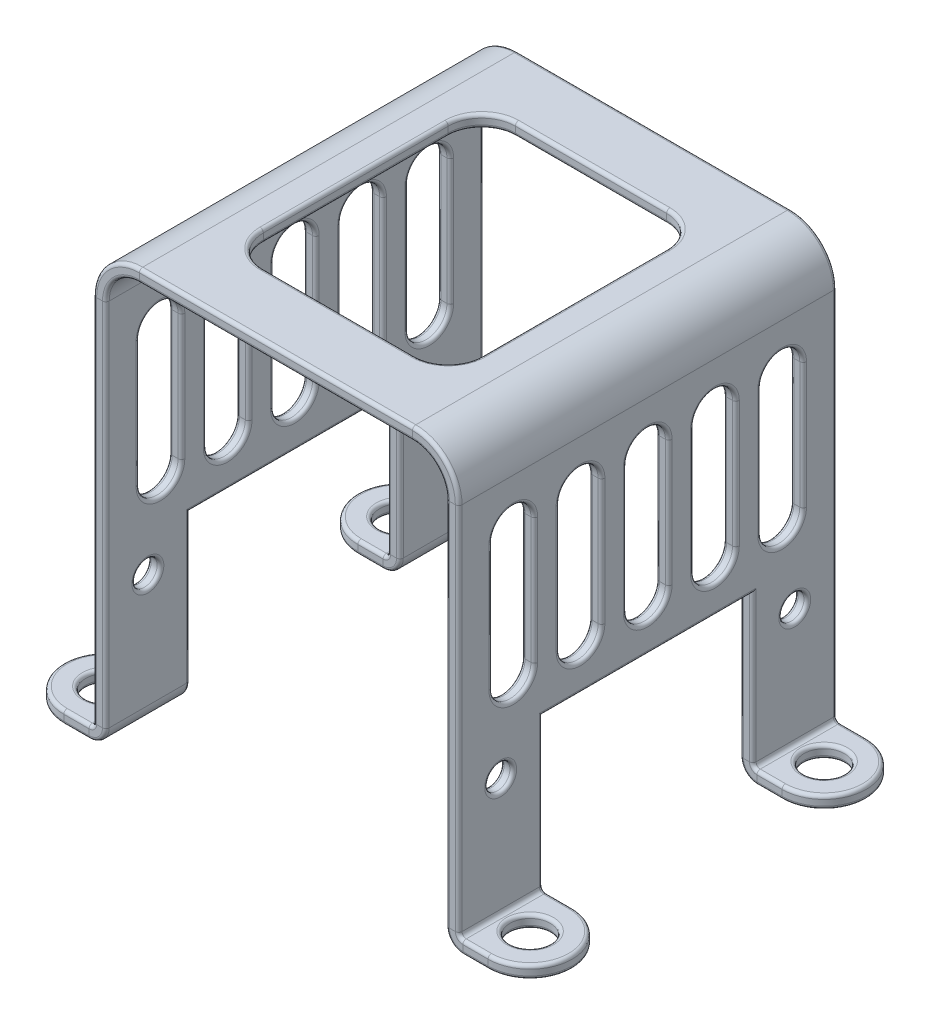
from build123d import *

# Parameters (mm, degrees)
BASE_FLANGE1_DEPTH             = 11.25
SKETCH6_R                      = 0.75
SKETCH6_W                      = 12.5
SKETCH6_H                      = 9.75
CUT_EXTRUDE1_DEPTH             = 36.534314402
EDGE_FLANGE1_STRIP_W           = 3.5
EDGE_FLANGE1_STRIP_H           = 0.75
EDGE_FLANGE1_STRIP_CUT_DEPTH   = 5
EDGE_FLANGE1_STRIP_2_W         = 3.5
EDGE_FLANGE1_STRIP_2_H         = 0.75
EDGE_FLANGE1_STRIP_CUT_2_DEPTH = 5
EDGE_FLANGE1_STRIP_3_W         = 3.5
EDGE_FLANGE1_STRIP_3_H         = 0.75
EDGE_FLANGE1_STRIP_CUT_3_DEPTH = 5
EDGE_FLANGE1_STRIP_4_W         = 3.5
EDGE_FLANGE1_STRIP_4_H         = 0.75
EDGE_FLANGE1_STRIP_CUT_4_DEPTH = 5
EDGE_FLANGE1_DEPTH             = 5
EDGE_FLANGE1_BEND_DEPTH        = 5
EDGE_FLANGE1_BEND_2_DEPTH      = 5
EDGE_FLANGE1_BEND_3_DEPTH      = 5
CUT_EXTRUDE2_DEPTH             = 10
FILLET1_RADIUS                 = 2.5
FILLET1_LENGTH                 = 0.75
FILLET2_RADIUS                 = 2.5
FILLET2_LENGTH                 = 0.75
FILLET3_RADIUS                 = 2.5
FILLET3_LENGTH                 = 0.75
FILLET4_RADIUS                 = 2.5
FILLET4_LENGTH                 = 0.75
M2_CLEARANCE_HOLE1_D           = 2.4
FILLET5_R                      = 0.2


# Sheet-metal steps are written as plain solids
with BuildPart() as part:
    # Sketch1 → Base-Flange1 (new, symmetric)
    with BuildSketch(Plane.XY):
        with BuildLine():
            Line((-10.125, 0), (-10.125, 23))
            ThreePointArc((-10.125, 23), (-9.539213562, 24.414213562), (-8.125, 25))
            Line((-8.125, 25), (8.125, 25))
            ThreePointArc((8.125, 25), (9.539213562, 24.414213562), (10.125, 23))
            Line((10.125, 23), (10.125, 0))
            Line((10.125, 0), (10.875, 0))
            Line((10.875, 0), (10.875, 23))
            ThreePointArc((10.875, 23), (10.069543648, 24.944543648), (8.125, 25.75))
            Line((8.125, 25.75), (-8.125, 25.75))
            ThreePointArc((-8.125, 25.75), (-10.069543648, 24.944543648), (-10.875, 23))
            Line((-10.875, 23), (-10.875, 0))
            Line((-10.875, 0), (-10.125, 0))
        make_face()
    extrude(amount=BASE_FLANGE1_DEPTH, both=True)

    # Sketch6 → Cut-Extrude1 (cut, through all)
    with BuildSketch(Plane(origin=(10.875, 0, 0), x_dir=(0, 0, -1), z_dir=(1, 0, 0))):
        with Locations((8.75, 7.75)):
            Circle(SKETCH6_R)
        with Locations(Location((-8.75, 7.75, 0), (0, 0, 180))):
            Circle(SKETCH6_R)
        with Locations((0, 4.875)):
            Rectangle(SKETCH6_W, SKETCH6_H)
        with BuildLine():
            Line((1.25, 20.125), (1.25, 12.625))
            ThreePointArc((1.25, 12.625), (0, 11.375), (-1.25, 12.625))
            Line((-1.25, 12.625), (-1.25, 20.125))
            ThreePointArc((-1.25, 20.125), (0, 21.375), (1.25, 20.125))
        make_face()
        with BuildLine():
            Line((2.75, 20.125), (2.75, 12.625))
            ThreePointArc((2.75, 12.625), (4, 11.375), (5.25, 12.625))
            Line((5.25, 12.625), (5.25, 20.125))
            ThreePointArc((5.25, 20.125), (4, 21.375), (2.75, 20.125))
        make_face()
        with BuildLine():
            Line((6.75, 20.125), (6.75, 12.625))
            ThreePointArc((6.75, 12.625), (8, 11.375), (9.25, 12.625))
            Line((9.25, 12.625), (9.25, 20.125))
            ThreePointArc((9.25, 20.125), (8, 21.375), (6.75, 20.125))
        make_face()
        with BuildLine():
            Line((-9.25, 20.125), (-9.25, 12.625))
            ThreePointArc((-9.25, 12.625), (-8, 11.375), (-6.75, 12.625))
            Line((-6.75, 12.625), (-6.75, 20.125))
            ThreePointArc((-6.75, 20.125), (-8, 21.375), (-9.25, 20.125))
        make_face()
        with BuildLine():
            Line((-5.25, 20.125), (-5.25, 12.625))
            ThreePointArc((-5.25, 12.625), (-4, 11.375), (-2.75, 12.625))
            Line((-2.75, 12.625), (-2.75, 20.125))
            ThreePointArc((-2.75, 20.125), (-4, 21.375), (-5.25, 20.125))
        make_face()
    extrude(amount=-CUT_EXTRUDE1_DEPTH, mode=Mode.SUBTRACT)

    # Edge-Flange1 strip (across the edge) → Edge-Flange1 strip cut (cut)
    with BuildSketch(Plane(origin=(10.875, 0, -6.25), x_dir=(0, 1, 0), z_dir=(0, 0, -1))):
        with Locations((-0.75, -0.375)):
            Rectangle(EDGE_FLANGE1_STRIP_W, EDGE_FLANGE1_STRIP_H)
    extrude(amount=EDGE_FLANGE1_STRIP_CUT_DEPTH, mode=Mode.SUBTRACT)

    # Edge-Flange1 strip 2 (across the edge) → Edge-Flange1 strip cut 2 (cut)
    with BuildSketch(Plane(origin=(10.875, 0, 11.25), x_dir=(0, 1, 0), z_dir=(0, 0, -1))):
        with Locations((-0.75, -0.375)):
            Rectangle(EDGE_FLANGE1_STRIP_2_W, EDGE_FLANGE1_STRIP_2_H)
    extrude(amount=EDGE_FLANGE1_STRIP_CUT_2_DEPTH, mode=Mode.SUBTRACT)

    # Edge-Flange1 strip 3 (across the edge) → Edge-Flange1 strip cut 3 (cut)
    with BuildSketch(Plane(origin=(-10.875, 0, 6.25), x_dir=(0, 1, 0), z_dir=(0, 0, 1))):
        with Locations((-0.75, -0.375)):
            Rectangle(EDGE_FLANGE1_STRIP_3_W, EDGE_FLANGE1_STRIP_3_H)
    extrude(amount=EDGE_FLANGE1_STRIP_CUT_3_DEPTH, mode=Mode.SUBTRACT)

    # Edge-Flange1 strip 4 (across the edge) → Edge-Flange1 strip cut 4 (cut)
    with BuildSketch(Plane(origin=(-10.875, 0, -11.25), x_dir=(0, 1, 0), z_dir=(0, 0, 1))):
        with Locations((-0.75, -0.375)):
            Rectangle(EDGE_FLANGE1_STRIP_4_W, EDGE_FLANGE1_STRIP_4_H)
    extrude(amount=EDGE_FLANGE1_STRIP_CUT_4_DEPTH, mode=Mode.SUBTRACT)

    # Edge-Flange1 section (across the edge) → Edge-Flange1 (add)
    with BuildSketch(Plane(origin=(10.875, 0, -6.25), x_dir=(0, 1, 0), z_dir=(0, 0, -1))):
        with BuildLine():
            Line((0, 0.25), (0, 4.25))
            Line((0, 4.25), (0.75, 4.25))
            Line((0.75, 4.25), (0.75, 0.25))
            ThreePointArc((0.75, 0.25), (0.823223305, 0.073223305), (1, 0))
            Line((1, 0), (1, -0.75))
            ThreePointArc((1, -0.75), (0.292893219, -0.457106781), (0, 0.25))
        make_face()
    extrude(amount=EDGE_FLANGE1_DEPTH)

    # Edge-Flange1 section 2 (across the edge) → Edge-Flange1 bend (add)
    with BuildSketch(Plane(origin=(10.875, 0, 11.25), x_dir=(0, 1, 0), z_dir=(0, 0, -1))):
        with BuildLine():
            Line((0, 0.25), (0, 4.25))
            Line((0, 4.25), (0.75, 4.25))
            Line((0.75, 4.25), (0.75, 0.25))
            ThreePointArc((0.75, 0.25), (0.823223305, 0.073223305), (1, 0))
            Line((1, 0), (1, -0.75))
            ThreePointArc((1, -0.75), (0.292893219, -0.457106781), (0, 0.25))
        make_face()
    extrude(amount=EDGE_FLANGE1_BEND_DEPTH)

    # Edge-Flange1 section 3 (across the edge) → Edge-Flange1 bend 2 (add)
    with BuildSketch(Plane(origin=(-10.875, 0, 6.25), x_dir=(0, 1, 0), z_dir=(0, 0, 1))):
        with BuildLine():
            Line((0, 0.25), (0, 4.25))
            Line((0, 4.25), (0.75, 4.25))
            Line((0.75, 4.25), (0.75, 0.25))
            ThreePointArc((0.75, 0.25), (0.823223305, 0.073223305), (1, 0))
            Line((1, 0), (1, -0.75))
            ThreePointArc((1, -0.75), (0.292893219, -0.457106781), (0, 0.25))
        make_face()
    extrude(amount=EDGE_FLANGE1_BEND_2_DEPTH)

    # Edge-Flange1 section 4 (across the edge) → Edge-Flange1 bend 3 (add)
    with BuildSketch(Plane(origin=(-10.875, 0, -11.25), x_dir=(0, 1, 0), z_dir=(0, 0, 1))):
        with BuildLine():
            Line((0, 0.25), (0, 4.25))
            Line((0, 4.25), (0.75, 4.25))
            Line((0.75, 4.25), (0.75, 0.25))
            ThreePointArc((0.75, 0.25), (0.823223305, 0.073223305), (1, 0))
            Line((1, 0), (1, -0.75))
            ThreePointArc((1, -0.75), (0.292893219, -0.457106781), (0, 0.25))
        make_face()
    extrude(amount=EDGE_FLANGE1_BEND_3_DEPTH)

    # Sketch19 → Cut-Extrude2 (cut)
    with BuildSketch(Plane(origin=(0, 25.75, 0), x_dir=(1, 0, 0), z_dir=(0, 1, 0))):
        with BuildLine():
            Line((4.5, -7.5), (-4.5, -7.5))
            ThreePointArc((-4.5, -7.5), (-5.914213562, -6.914213562), (-6.5, -5.5))
            Line((-6.5, -5.5), (-6.5, 5.5))
            ThreePointArc((-6.5, 5.5), (-5.914213562, 6.914213562), (-4.5, 7.5))
            Line((-4.5, 7.5), (4.5, 7.5))
            ThreePointArc((4.5, 7.5), (5.914213562, 6.914213562), (6.5, 5.5))
            Line((6.5, 5.5), (6.5, -5.5))
            ThreePointArc((6.5, -5.5), (5.914213562, -6.914213562), (4.5, -7.5))
        make_face()
    extrude(amount=-CUT_EXTRUDE2_DEPTH, mode=Mode.SUBTRACT)

    # Fillet1: full round fillet: the end face becomes a half cylinder, R = half its width
    fillet1_face = Plane((-15.125, 0.375, 8.75), x_dir=(0, -1, 0), z_dir=(-1, 0, 0))  # on the end face: x along it, z out of the body
    fillet1_slab = fillet1_face.offset(-FILLET1_RADIUS / 2) * Box(FILLET1_LENGTH, 2 * FILLET1_RADIUS, FILLET1_RADIUS, mode=Mode.PRIVATE)  # the body's end, R deep
    fillet1_round = Plane((-12.625, 0.375, 8.75), x_dir=(-1, 0, 0), z_dir=(0, -1, 0)) * Cylinder(FILLET1_RADIUS, FILLET1_LENGTH, mode=Mode.PRIVATE)  # its axis R under the face
    add(fillet1_slab - fillet1_round, mode=Mode.SUBTRACT)

    # Fillet2: full round fillet: the end face becomes a half cylinder, R = half its width
    fillet2_face = Plane((-15.125, 0.375, -8.75), x_dir=(0, -1, 0), z_dir=(-1, 0, 0))  # on the end face: x along it, z out of the body
    fillet2_slab = fillet2_face.offset(-FILLET2_RADIUS / 2) * Box(FILLET2_LENGTH, 2 * FILLET2_RADIUS, FILLET2_RADIUS, mode=Mode.PRIVATE)  # the body's end, R deep
    fillet2_round = Plane((-12.625, 0.375, -8.75), x_dir=(-1, 0, 0), z_dir=(0, -1, 0)) * Cylinder(FILLET2_RADIUS, FILLET2_LENGTH, mode=Mode.PRIVATE)  # its axis R under the face
    add(fillet2_slab - fillet2_round, mode=Mode.SUBTRACT)

    # Fillet3: full round fillet: the end face becomes a half cylinder, R = half its width
    fillet3_face = Plane((15.125, 0.375, -8.75), x_dir=(0, -1, 0), z_dir=(1, 0, 0))  # on the end face: x along it, z out of the body
    fillet3_slab = fillet3_face.offset(-FILLET3_RADIUS / 2) * Box(FILLET3_LENGTH, 2 * FILLET3_RADIUS, FILLET3_RADIUS, mode=Mode.PRIVATE)  # the body's end, R deep
    fillet3_round = Plane((12.625, 0.375, -8.75), x_dir=(1, 0, 0), z_dir=(0, -1, 0)) * Cylinder(FILLET3_RADIUS, FILLET3_LENGTH, mode=Mode.PRIVATE)  # its axis R under the face
    add(fillet3_slab - fillet3_round, mode=Mode.SUBTRACT)

    # Fillet4: full round fillet: the end face becomes a half cylinder, R = half its width
    fillet4_face = Plane((15.125, 0.375, 8.75), x_dir=(0, -1, 0), z_dir=(1, 0, 0))  # on the end face: x along it, z out of the body
    fillet4_slab = fillet4_face.offset(-FILLET4_RADIUS / 2) * Box(FILLET4_LENGTH, 2 * FILLET4_RADIUS, FILLET4_RADIUS, mode=Mode.PRIVATE)  # the body's end, R deep
    fillet4_round = Plane((12.625, 0.375, 8.75), x_dir=(1, 0, 0), z_dir=(0, -1, 0)) * Cylinder(FILLET4_RADIUS, FILLET4_LENGTH, mode=Mode.PRIVATE)  # its axis R under the face
    add(fillet4_slab - fillet4_round, mode=Mode.SUBTRACT)

    # M2 Clearance Hole1 (through all)
    with Locations(Plane(origin=(0, 0.75, 0), x_dir=(1, 0, 0), z_dir=(0, 1, 0))):
        with Locations((-12.625, 8.75), (12.625, 8.75), (12.625, -8.75), (-12.625, -8.75)):
            Hole(M2_CLEARANCE_HOLE1_D / 2)

    # Fillet5
    fillet5_edges = [part.edges().sort_by_distance(p)[0] for p in [
        (10.125, 7.75, -8),
        (-10.125, 7.75, -8),
        (-10.875, 7.75, -8),
        (10.875, 7.75, -8),
        (10.125, 7.75, 8),
        (-10.125, 7.75, 8),
        (-10.875, 7.75, 8),
        (10.875, 7.75, 8),
        (-10.069543648, 24.944543648, -11.25),
        (0, 25.75, -11.25),
        (-10.125, 21.375, 0),
        (10.125, 21.375, 0),
        (-10.875, 21.375, 0),
        (-10.125, 16.375, -1.25),
        (10.069543648, 24.944543648, -11.25),
        (10.125, 16.375, -1.25),
        (-10.875, 16.375, -1.25),
        (-10.125, 11.375, 0),
        (10.125, 11.375, 0),
        (-10.875, 11.375, 0),
        (-10.125, 16.375, 1.25),
        (10.125, 16.375, 1.25),
        (-10.875, 16.375, 1.25),
        (10.875, 21.375, 0),
        (10.875, 16.375, 1.25),
        (10.875, 11.375, 0),
        (10.875, 16.375, -1.25),
        (9.539213562, 24.414213562, -11.25),
        (-10.125, 21.375, -4),
        (10.125, 21.375, -4),
        (-10.875, 21.375, -4),
        (-10.125, 16.375, -5.25),
        (10.125, 16.375, -5.25),
        (-10.875, 16.375, -5.25),
        (-10.125, 11.375, -4),
        (0, 25, -11.25),
        (10.125, 11.375, -4),
        (-10.875, 11.375, -4),
        (-10.125, 16.375, -2.75),
        (10.125, 16.375, -2.75),
        (-10.875, 16.375, -2.75),
        (-10.125, 12, 11.25),
        (10.875, 21.375, -4),
        (10.875, 16.375, -2.75),
        (10.875, 11.375, -4),
        (10.875, 16.375, -5.25),
        (-9.539213562, 24.414213562, -11.25),
        (-10.125, 12, -11.25),
        (-10.125, 21.375, 4),
        (10.125, 21.375, 4),
        (-10.875, 21.375, 4),
        (-10.125, 16.375, 2.75),
        (10.125, 16.375, 2.75),
        (-10.875, 16.375, 2.75),
        (-10.125, 11.375, 4),
        (10.125, 11.375, 4),
        (-10.875, 11.375, 4),
        (-10.125, 16.375, 5.25),
        (-10.875, 12, -11.25),
        (10.125, 16.375, 5.25),
        (-10.875, 16.375, 5.25),
        (10.875, 21.375, 4),
        (10.875, 16.375, 5.25),
        (10.875, 11.375, 4),
        (10.875, 16.375, 2.75),
        (-10.125, 21.375, 8),
        (10.125, 21.375, 8),
        (-10.875, 21.375, 8),
        (-10.125, 16.375, 6.75),
        (10.125, 16.375, 6.75),
        (-10.875, 16.375, 6.75),
        (-10.125, 11.375, 8),
        (10.125, 11.375, 8),
        (-10.875, 11.375, 8),
        (-10.125, 16.375, 9.25),
        (10.125, 16.375, 9.25),
        (-10.875, 16.375, 9.25),
        (10.875, 21.375, 8),
        (10.875, 16.375, 9.25),
        (10.875, 11.375, 8),
        (10.875, 16.375, 6.75),
        (-9.539213562, 24.414213562, 11.25),
        (-10.125, 21.375, -8),
        (10.125, 21.375, -8),
        (-10.875, 21.375, -8),
        (-10.125, 16.375, -9.25),
        (10.125, 16.375, -9.25),
        (-10.875, 16.375, -9.25),
        (-10.125, 11.375, -8),
        (10.125, 11.375, -8),
        (-10.875, 11.375, -8),
        (-10.125, 16.375, -6.75),
        (10.125, 16.375, -6.75),
        (-10.875, 16.375, -6.75),
        (10.875, 21.375, -8),
        (10.875, 16.375, -6.75),
        (10.875, 11.375, -8),
        (10.875, 16.375, -9.25),
        (-10.125, 5.375, 6.25),
        (-10.875, 5.375, 6.25),
        (-10.125, 9.75, 0),
        (10.125, 9.75, 0),
        (-10.875, 9.75, 0),
        (10.125, 5.375, -6.25),
        (10.875, 5.375, 6.25),
        (10.875, 9.75, 0),
        (0, 25, 11.25),
        (9.539213562, 24.414213562, 11.25),
        (10.875, 5.375, -6.25),
        (10.875, 12, -11.25),
        (10.125, 12, -11.25),
        (10.125, 5.375, 6.25),
        (10.875, 12, 11.25),
        (10.125, 12, 11.25),
        (-10.125, 5.375, -6.25),
        (-10.875, 5.375, -6.25),
        (10.417893219, 0.292893219, -6.25),
        (10.417893219, 0.292893219, -11.25),
        (10.948223305, 0.823223305, -6.25),
        (10.948223305, 0.823223305, -11.25),
        (11.875, 0.75, -11.25),
        (11.875, 0, -11.25),
        (10.417893219, 0.292893219, 11.25),
        (10.417893219, 0.292893219, 6.25),
        (10.948223305, 0.823223305, 11.25),
        (10.948223305, 0.823223305, 6.25),
        (11.875, 0.75, 6.25),
        (11.875, 0, 6.25),
        (-10.417893219, 0.292893219, 6.25),
        (-10.417893219, 0.292893219, 11.25),
        (-10.948223305, 0.823223305, 6.25),
        (-10.948223305, 0.823223305, 11.25),
        (-11.875, 0.75, 11.25),
        (-11.875, 0, 11.25),
        (-10.417893219, 0.292893219, -11.25),
        (-10.417893219, 0.292893219, -6.25),
        (-10.948223305, 0.823223305, -11.25),
        (-10.948223305, 0.823223305, -6.25),
        (-11.875, 0.75, -6.25),
        (-11.875, 0, -6.25),
        (10.069543648, 24.944543648, 11.25),
        (-5.914213562, 25, 6.914213562),
        (-6.5, 25, 0),
        (-5.914213562, 25, -6.914213562),
        (0, 25, -7.5),
        (5.914213562, 25, -6.914213562),
        (6.5, 25, 0),
        (5.914213562, 25, 6.914213562),
        (0, 25, 7.5),
        (-5.914213562, 25.75, 6.914213562),
        (0, 25.75, 7.5),
        (5.914213562, 25.75, 6.914213562),
        (6.5, 25.75, 0),
        (5.914213562, 25.75, -6.914213562),
        (0, 25.75, -7.5),
        (-5.914213562, 25.75, -6.914213562),
        (-6.5, 25.75, 0),
        (-11.875, 0, 6.25),
        (-11.875, 0.75, 6.25),
        (-15.125, 0.75, 8.75),
        (0, 25.75, 11.25),
        (-15.125, 0, 8.75),
        (-11.875, 0, -11.25),
        (-11.875, 0.75, -11.25),
        (-15.125, 0.75, -8.75),
        (-15.125, 0, -8.75),
        (11.875, 0, -6.25),
        (11.875, 0.75, -6.25),
        (15.125, 0.75, -8.75),
        (15.125, 0, -8.75),
        (11.875, 0, 11.25),
        (11.875, 0.75, 11.25),
        (15.125, 0, 8.75),
        (15.125, 0.75, 8.75),
        (-10.875, 12, 11.25),
        (-11.425, 0.75, 8.75),
        (-11.425, 0, 8.75),
        (13.825, 0.75, 8.75),
        (13.825, 0, 8.75),
        (-10.069543648, 24.944543648, 11.25),
        (13.825, 0.75, -8.75),
        (13.825, 0, -8.75),
        (-11.425, 0.75, -8.75),
        (-11.425, 0, -8.75),
    ]]
    fillet(fillet5_edges, radius=FILLET5_R)


solid = part.part
